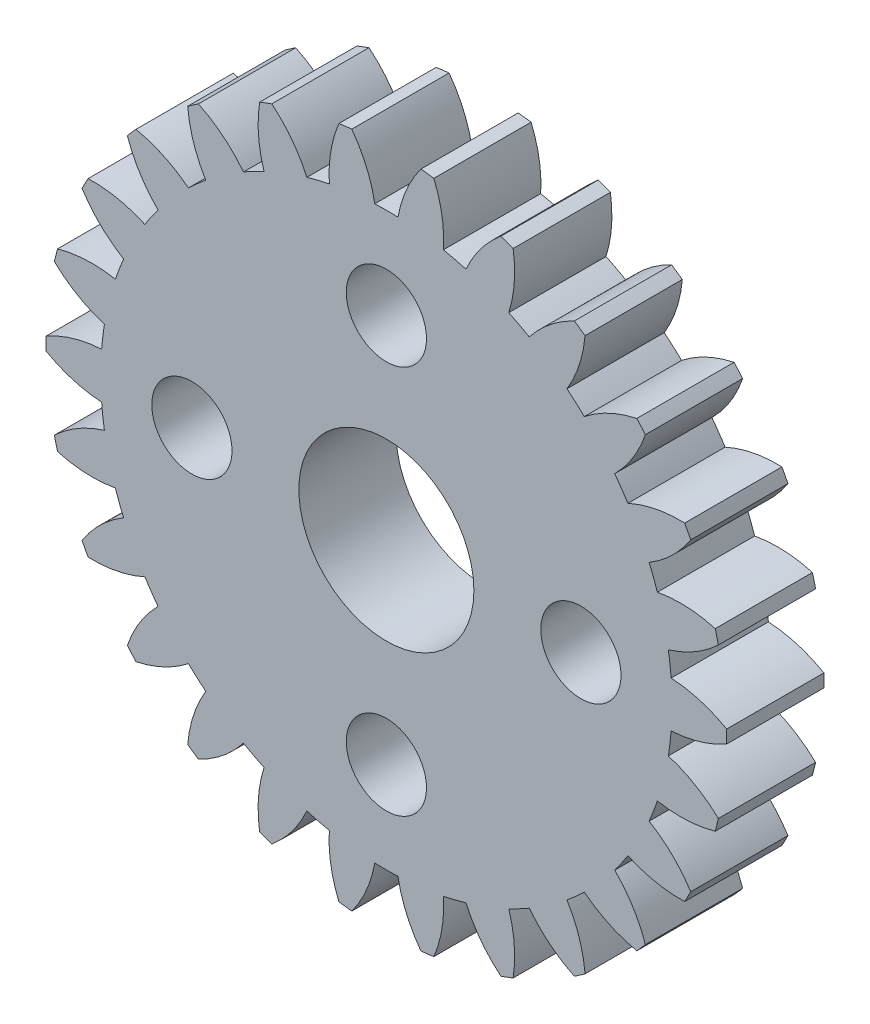
from build123d import *

# Parameters (mm, degrees)
SKETCH_1_R               = 14
EXTRUDE_1_DEPTH          = 4
CUT_EXTRUDE_1_REACH      = 22.199
PATTERN_CIRCULAR_1_COUNT = 26
CUT_EXTRUDE_2_REACH      = 22.149
SKETCH_5_R               = 3.6
SKETCH_5_R_2             = 1.65


with BuildPart() as part:
    # 草圖1 → 填料-伸長1 (new body)
    with BuildSketch(Plane.XY):
        Circle(SKETCH_1_R)
    extrude(amount=EXTRUDE_1_DEPTH)

    # 草圖4 → 除料-伸長1 (cut, up to next)
    with BuildSketch(Plane.XY.offset(4), mode=Mode.PRIVATE) as cut_extrude_1_sk1:
        with BuildLine():
            ThreePointArc((-1.421594657, 13.927636865), (0, 14), (1.421594657, 13.927636865))
            ThreePointArc((1.421594657, 13.927636865), (0.822322703, 12.888806427), (0.476978653, 11.74031479))
            ThreePointArc((0.476978653, 11.74031479), (0, 11.75), (-0.476978653, 11.74031479))
            ThreePointArc((-0.476978653, 11.74031479), (-0.822322703, 12.888806427), (-1.421594657, 13.927636865))
        make_face()
    cut_extrude_1_tool1 = extrude(cut_extrude_1_sk1.sketch, amount=-CUT_EXTRUDE_1_REACH, mode=Mode.PRIVATE) & part.part
    cut_extrude_1 = cut_extrude_1_tool1.solids().sort_by_distance((0, 13.069274, 4))[0]
    add(cut_extrude_1, mode=Mode.SUBTRACT)

    # 環狀複製排列1: 除料-伸長1 ×26 about axis
    pattern_circular_1_axis = Axis((0, 0, 0), (0, 0, 1))
    for i in range(1, PATTERN_CIRCULAR_1_COUNT):
        add(cut_extrude_1.rotate(pattern_circular_1_axis, i * 360 / PATTERN_CIRCULAR_1_COUNT), mode=Mode.SUBTRACT)

    # 草圖5 → 除料-伸長2 (cut, up to next)
    with BuildSketch(Plane.XY.offset(4), mode=Mode.PRIVATE) as cut_extrude_2_sk1:
        Circle(SKETCH_5_R)
    cut_extrude_2_tool1 = extrude(cut_extrude_2_sk1.sketch, amount=-CUT_EXTRUDE_2_REACH, mode=Mode.PRIVATE) & part.part
    # 草圖5 → 除料-伸長2 (cut, up to next)
    with BuildSketch(Plane.XY.offset(4), mode=Mode.PRIVATE) as cut_extrude_2_sk2:
        with Locations((0, 8)):
            Circle(SKETCH_5_R_2)
    cut_extrude_2_tool2 = extrude(cut_extrude_2_sk2.sketch, amount=-CUT_EXTRUDE_2_REACH, mode=Mode.PRIVATE) & part.part
    # 草圖5 → 除料-伸長2 (cut, up to next)
    with BuildSketch(Plane.XY.offset(4), mode=Mode.PRIVATE) as cut_extrude_2_sk3:
        with Locations((8, 0)):
            Circle(SKETCH_5_R_2)
    cut_extrude_2_tool3 = extrude(cut_extrude_2_sk3.sketch, amount=-CUT_EXTRUDE_2_REACH, mode=Mode.PRIVATE) & part.part
    # 草圖5 → 除料-伸長2 (cut, up to next)
    with BuildSketch(Plane.XY.offset(4), mode=Mode.PRIVATE) as cut_extrude_2_sk4:
        with Locations((0, -8)):
            Circle(SKETCH_5_R_2)
    cut_extrude_2_tool4 = extrude(cut_extrude_2_sk4.sketch, amount=-CUT_EXTRUDE_2_REACH, mode=Mode.PRIVATE) & part.part
    # 草圖5 → 除料-伸長2 (cut, up to next)
    with BuildSketch(Plane.XY.offset(4), mode=Mode.PRIVATE) as cut_extrude_2_sk5:
        with Locations((-8, 0)):
            Circle(SKETCH_5_R_2)
    cut_extrude_2_tool5 = extrude(cut_extrude_2_sk5.sketch, amount=-CUT_EXTRUDE_2_REACH, mode=Mode.PRIVATE) & part.part
    add(cut_extrude_2_tool1.solids().sort_by_distance((0, 0, 4))[0], mode=Mode.SUBTRACT)
    add(cut_extrude_2_tool2.solids().sort_by_distance((0, 8, 4))[0], mode=Mode.SUBTRACT)
    add(cut_extrude_2_tool3.solids().sort_by_distance((8, 0, 4))[0], mode=Mode.SUBTRACT)
    add(cut_extrude_2_tool4.solids().sort_by_distance((0, -8, 4))[0], mode=Mode.SUBTRACT)
    add(cut_extrude_2_tool5.solids().sort_by_distance((-8, 0, 4))[0], mode=Mode.SUBTRACT)


solid = part.part
